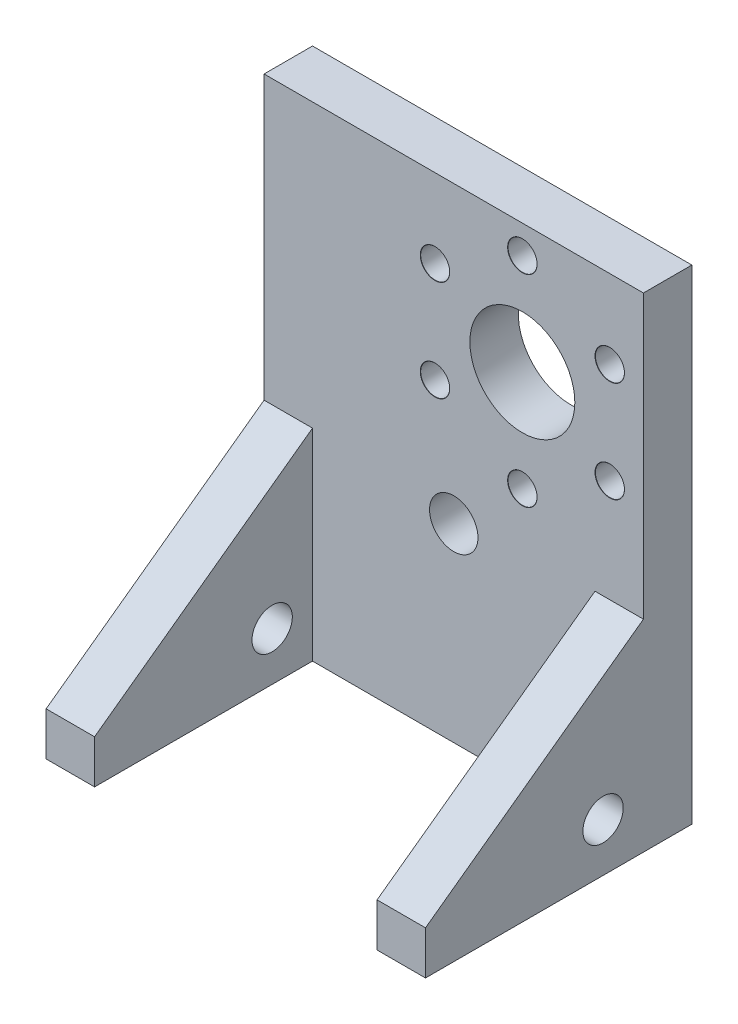
from build123d import *

# Parameters (mm, degrees)
SKETCH1_W                      = 6
SKETCH1_H                      = 27
BOSS_EXTRUDE1_DEPTH            = 5
BOSS_EXTRUDE2_START            = 5
BOSS_EXTRUDE2_DEPTH            = 55
CHAMFER1_SIZE                  = 20
CHAMFER1_SIZE_2                = 27.527638409
M3_CLEARANCE_HOLE1_D           = 3.6
M3_CLEARANCE_HOLE1_CSINK_D     = 3.65
M3_CLEARANCE_HOLE1_CSINK_ANGLE = 90
CUT_EXTRUDE1_DEPTH             = 70.865943062
CUT_EXTRUDE1_DEPTH_BACK        = 70.865943062
SKETCH4_R                      = 6.5
F_5_3_5_3_DIAMETER_HOLE1_D     = 5.3
F_5_3_5_3_DIAMETER_HOLE1_DEPTH = 7
F_5_3_5_3_DIAMETER_HOLE1_TIP   = 1.59228064
SKETCH10_R                     = 3
CUT_EXTRUDE2_DEPTH             = 10
SKETCH11_R                     = 2.5
CUT_EXTRUDE3_DEPTH             = 81.857900047


with BuildPart() as part:
    # Sketch1 → Boss-Extrude1 (new body)
    with BuildSketch(Plane(origin=(0, 0, 0), x_dir=(1, 0, 0), z_dir=(0, 1, 0))):
        with Locations((-20.5, -13.5)):
            Rectangle(SKETCH1_W, SKETCH1_H)
        Polygon((-23.5, 0), (-17.5, 0), (17.5, 0), (23.5, 0), (23.5, 6), (-23.5, 6), align=None)
        with Locations((20.5, -13.5)):
            Rectangle(SKETCH1_W, SKETCH1_H)
    extrude(amount=BOSS_EXTRUDE1_DEPTH)

    # Sketch1<3> → Boss-Extrude2 (add)
    with BuildSketch(Plane(origin=(0, 0, 0), x_dir=(1, 0, 0), z_dir=(0, 1, 0)).offset(BOSS_EXTRUDE2_START)):
        Polygon((-23.5, 0), (-17.5, 0), (17.5, 0), (23.5, 0), (23.5, 6), (-23.5, 6), align=None)
    extrude(amount=BOSS_EXTRUDE2_DEPTH)

    # Chamfer1
    # the kernel refuses this chamfer: 27.527638409, 20 mm, written as the material it adds along each edge
    with BuildSketch(Plane(origin=(-53.564551252, 5, 0), x_dir=(0, 0.9990705747005859, -0.043104370630376254), z_dir=(1, 0, 0))) as chamfer1_piece_1_section:
        Polygon((CHAMFER1_SIZE * 0.999070574701, CHAMFER1_SIZE * 0.0431043706304), (-CHAMFER1_SIZE_2 * 0.043104370631, CHAMFER1_SIZE_2 * 0.999070574716), (0, 0), align=None)
    chamfer1_piece_1 = extrude(amount=77.064551252, mode=Mode.PRIVATE)
    chamfer1_piece_1 = split(chamfer1_piece_1, bisect_by=Plane(origin=(-23.5, 11.537219217, 9.073559483), z_dir=(1, 0, 0)), keep=Keep.TOP, mode=Mode.PRIVATE)
    chamfer1_piece_1 = split(chamfer1_piece_1, bisect_by=Plane(origin=(-17.5, 11.537219217, 9.073559483), z_dir=(-1, 0, 0)), keep=Keep.TOP, mode=Mode.PRIVATE)
    chamfer1_piece_1 = split(chamfer1_piece_1, bisect_by=Plane(origin=(-20.5, 11.537219217, 27), z_dir=(0, 0, -1)), keep=Keep.TOP, mode=Mode.PRIVATE)
    add(chamfer1_piece_1)
    with BuildSketch(Plane(origin=(17.5, 5, 0), x_dir=(0, 0.9990705747005859, -0.04310437063037649), z_dir=(1, 0, 0))) as chamfer1_piece_2_section:
        Polygon((CHAMFER1_SIZE * 0.999070574701, CHAMFER1_SIZE * 0.0431043706304), (-CHAMFER1_SIZE_2 * 0.043104370631, CHAMFER1_SIZE_2 * 0.999070574716), (0, 0), align=None)
    chamfer1_piece_2 = extrude(amount=6, mode=Mode.PRIVATE)
    chamfer1_piece_2 = split(chamfer1_piece_2, bisect_by=Plane(origin=(20.5, 11.537219217, 27), z_dir=(0, 0, -1)), keep=Keep.TOP, mode=Mode.PRIVATE)
    add(chamfer1_piece_2)
    with BuildSketch(Plane(origin=(-23.5, 5, 0), x_dir=(0, -0.022768510603911572, 0.9997407638607518), z_dir=(1, 0, 0))) as chamfer1_piece_3_section:
        Polygon((CHAMFER1_SIZE_2 * 0.999740763876, -CHAMFER1_SIZE_2 * 0.0227685106043), (-CHAMFER1_SIZE * 0.0227685106039, -CHAMFER1_SIZE * 0.999740763861), (0, 0), align=None)
    chamfer1_piece_3 = extrude(amount=6, mode=Mode.PRIVATE)
    chamfer1_piece_3 = split(chamfer1_piece_3, bisect_by=Plane(origin=(-20.5, 11.537219217, 27), z_dir=(0, 0, -1)), keep=Keep.TOP, mode=Mode.PRIVATE)
    add(chamfer1_piece_3)
    with BuildSketch(Plane(origin=(-23.5, 5, 0), x_dir=(0, -0.022768510603911572, 0.9997407638607518), z_dir=(1, 0, 0))) as chamfer1_piece_4_section:
        Polygon((CHAMFER1_SIZE_2 * 0.999740763876, -CHAMFER1_SIZE_2 * 0.0227685106043), (-CHAMFER1_SIZE * 0.0227685106039, -CHAMFER1_SIZE * 0.999740763861), (0, 0), align=None)
    chamfer1_piece_4 = extrude(amount=77.064551252, mode=Mode.PRIVATE)
    chamfer1_piece_4 = split(chamfer1_piece_4, bisect_by=Plane(origin=(20.5, 11.537219217, 27), z_dir=(0, 0, -1)), keep=Keep.TOP, mode=Mode.PRIVATE)
    chamfer1_piece_4 = split(chamfer1_piece_4, bisect_by=Plane(origin=(23.5, 11.537219217, 9.073559483), z_dir=(-1, 0, 0)), keep=Keep.TOP, mode=Mode.PRIVATE)
    chamfer1_piece_4 = split(chamfer1_piece_4, bisect_by=Plane(origin=(17.5, 11.537219217, 9.073559483), z_dir=(1, 0, 0)), keep=Keep.TOP, mode=Mode.PRIVATE)
    add(chamfer1_piece_4)

    # M3 Clearance Hole1 (through all)
    with Locations(Plane.XY):
        with Locations((8.5, 56.5), (19.325317547, 50.25), (19.325317547, 37.75), (8.5, 31.5), (-2.325317547, 37.75), (-2.325317547, 50.25)):
            CounterSinkHole(M3_CLEARANCE_HOLE1_D / 2, M3_CLEARANCE_HOLE1_CSINK_D / 2, counter_sink_angle=M3_CLEARANCE_HOLE1_CSINK_ANGLE)

    # Sketch4 → Cut-Extrude1 (cut, two sides: drawn at the far end of the back side and taken through both)
    with BuildSketch(Plane.XY.offset(-CUT_EXTRUDE1_DEPTH_BACK)):
        with Locations((8.5, 44)):
            Circle(SKETCH4_R)
    extrude(amount=CUT_EXTRUDE1_DEPTH + CUT_EXTRUDE1_DEPTH_BACK, mode=Mode.SUBTRACT)

    # Ø5.3 (5.3) Diameter Hole1
    with Locations(Plane(origin=(0, 0, 0), x_dir=(-1, 0, 0), z_dir=(0, -1, 0))):
        with Locations((-20.5, 3), (-20.5, -15), (20.5, 3), (20.5, -15)):
            Hole(F_5_3_5_3_DIAMETER_HOLE1_D / 2, depth=F_5_3_5_3_DIAMETER_HOLE1_DEPTH)
            with Locations((0, 0, -(F_5_3_5_3_DIAMETER_HOLE1_DEPTH + F_5_3_5_3_DIAMETER_HOLE1_TIP / 2))):  # 118° drill point
                Cone(0, F_5_3_5_3_DIAMETER_HOLE1_D / 2, F_5_3_5_3_DIAMETER_HOLE1_TIP, mode=Mode.SUBTRACT)

    # Sketch10 → Cut-Extrude2 (cut)
    with BuildSketch(Plane.XY):
        with Locations((0, 23.5)):
            Circle(SKETCH10_R)
    extrude(amount=-CUT_EXTRUDE2_DEPTH, mode=Mode.SUBTRACT)

    # Sketch11 → Cut-Extrude3 (cut, through all)
    with BuildSketch(Plane.ZY.offset(23.5)):
        with Locations((5, 6)):
            Circle(SKETCH11_R)
    extrude(amount=-CUT_EXTRUDE3_DEPTH, mode=Mode.SUBTRACT)


solid = part.part
